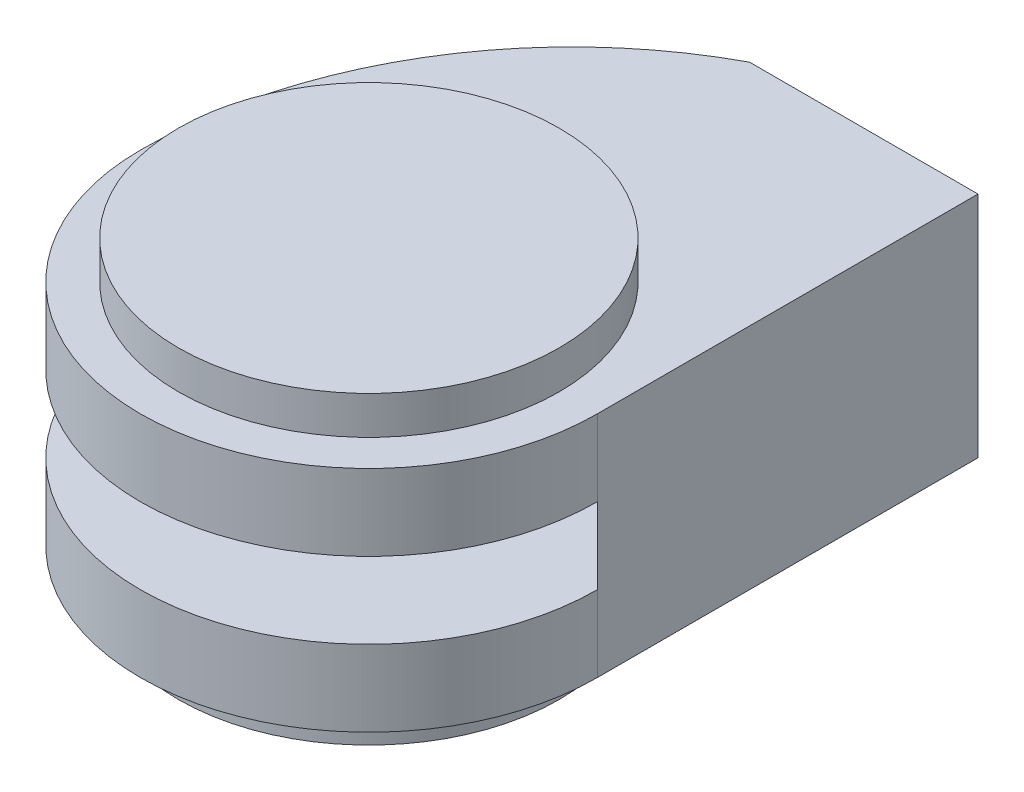
from build123d import *

# Parameters (mm, degrees)
BOSS_EXTRUDE1_DEPTH      = 1.5
BOSS_EXTRUDE1_DEPTH_BACK = 1.5
CUT_EXTRUDE1_DEPTH       = 0.5
CUT_EXTRUDE1_DEPTH_BACK  = 0.5
SKETCH3_R                = 2.5
BOSS_EXTRUDE2_DEPTH      = 0.5
BOSS_EXTRUDE3_START      = 0.5
SKETCH4_R                = 2.5
BOSS_EXTRUDE3_DEPTH      = 0.5


with BuildPart() as part:
    # Sketch1 → Boss-Extrude1 (new, two sides: drawn at the far end of the back side and taken through both)
    with BuildSketch(Plane(origin=(0, 0, 0), x_dir=(1, 0, 0), z_dir=(0, 1, 0)).offset(-BOSS_EXTRUDE1_DEPTH_BACK)):
        with BuildLine():
            ThreePointArc((0, 2.5), (-2.192459912, 0.415475947), (-3, -2.5))
            ThreePointArc((-3, -2.5), (0, -5.5), (3, -2.5))
            Line((3, -2.5), (3, 2.5))
            Line((3, 2.5), (0, 2.5))
        make_face()
    extrude(amount=BOSS_EXTRUDE1_DEPTH + BOSS_EXTRUDE1_DEPTH_BACK)

    # Sketch2 → Cut-Extrude1 (cut, two sides: drawn at the far end of the back side and taken through both)
    with BuildSketch(Plane(origin=(0, 0, 0), x_dir=(1, 0, 0), z_dir=(0, 1, 0)).offset(-CUT_EXTRUDE1_DEPTH_BACK)):
        with BuildLine():
            Line((-3, 4.742640687), (-3, -2.5))
            ThreePointArc((-3, -2.5), (1.148050297, -5.271638598), (2.121320344, -0.378679656))
            Line((2.121320344, -0.378679656), (-3, 4.742640687))
        make_face()
    extrude(amount=CUT_EXTRUDE1_DEPTH + CUT_EXTRUDE1_DEPTH_BACK, mode=Mode.SUBTRACT)

    # Sketch3 → Boss-Extrude2 (add)
    with BuildSketch(Plane(origin=(0, 1.5, 0), x_dir=(1, 0, 0), z_dir=(0, 1, 0))):
        with Locations((0, -2.5)):
            Circle(SKETCH3_R)
    extrude(amount=BOSS_EXTRUDE2_DEPTH)

    # Sketch4 → Boss-Extrude3 (add)
    with BuildSketch(Plane.XZ.offset(1.5).offset(BOSS_EXTRUDE3_START)):
        with Locations((0, 2.5)):
            Circle(SKETCH4_R)
    extrude(amount=-BOSS_EXTRUDE3_DEPTH)


solid = part.part
